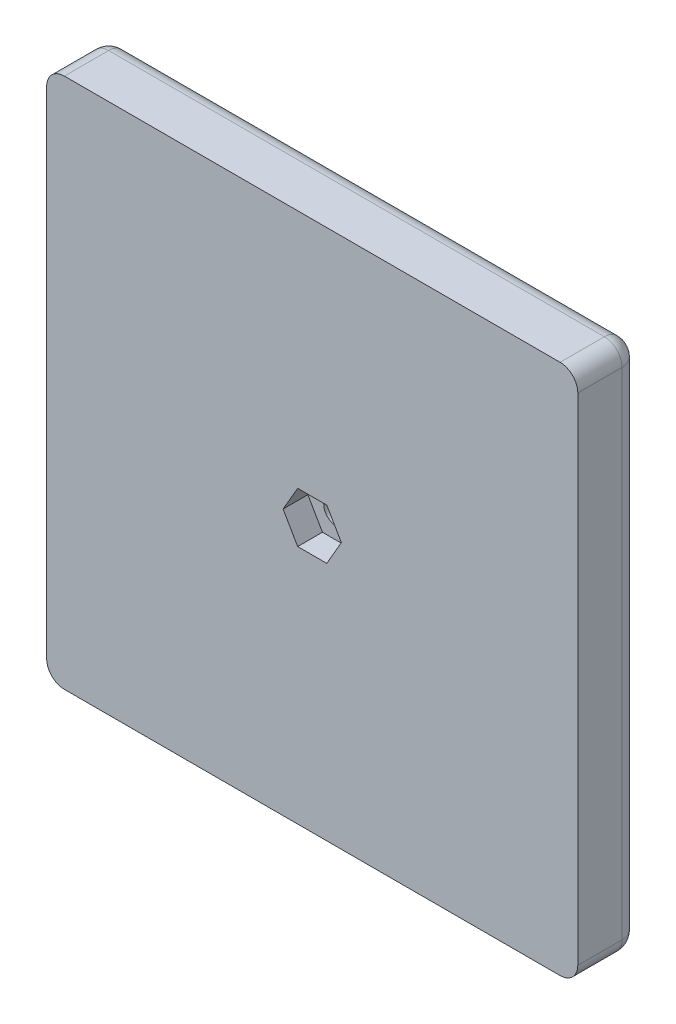
from build123d import *

# Parameters (mm, degrees)
ESBO_O1_W                = 23
ESBO_O1_H                = 23
RESSALTO_EXTRUS_O1_DEPTH = 10.25
CORTE_EXTRUS_O1_REACH    = 21.224
ESBO_O2_R                = 4.2
ESBO_O3_W                = 60
ESBO_O3_H                = 60
RESSALTO_EXTRUS_O2_DEPTH = 7
CORTE_EXTRUS_O2_REACH    = 45.647
ESBO_O4_R                = 1.5
CORTE_EXTRUS_O3_DEPTH    = 2.8
FILETE1_R                = 2
FILETE2_R                = 2


with BuildPart() as part:
    # Esboço1 → Ressalto-extrusão1 (new body)
    with BuildSketch(Plane.XY):
        Rectangle(ESBO_O1_W, ESBO_O1_H)
    extrude(amount=RESSALTO_EXTRUS_O1_DEPTH)

    # Esboço2 → Corte-extrusão1 (cut, up to next)
    with BuildSketch(Plane(origin=(0, 0, 0), x_dir=(-1, 0, 0), z_dir=(0, 0, -1)), mode=Mode.PRIVATE) as corte_extrus_o1_sk1:
        Circle(ESBO_O2_R)
    corte_extrus_o1_tool1 = extrude(corte_extrus_o1_sk1.sketch, amount=-CORTE_EXTRUS_O1_REACH, mode=Mode.PRIVATE) & part.part
    add(corte_extrus_o1_tool1.solids().sort_by_distance((0, 0, 0))[0], mode=Mode.SUBTRACT)

    # Esboço3 → Ressalto-extrusão2 (add)
    with BuildSketch(Plane.XY.offset(10.25)):
        Rectangle(ESBO_O3_W, ESBO_O3_H)
    extrude(amount=RESSALTO_EXTRUS_O2_DEPTH)

    # Esboço4 → Corte-extrusão2 (cut, up to next)
    with BuildSketch(Plane(origin=(0, 0, 10.25), x_dir=(-1, 0, 0), z_dir=(0, 0, -1)), mode=Mode.PRIVATE) as corte_extrus_o2_sk1:
        Circle(ESBO_O4_R)
    corte_extrus_o2_tool1 = extrude(corte_extrus_o2_sk1.sketch, amount=-CORTE_EXTRUS_O2_REACH, mode=Mode.PRIVATE) & part.part
    add(corte_extrus_o2_tool1.solids().sort_by_distance((0, 0, 10.25))[0], mode=Mode.SUBTRACT)

    # Esboço5 → Corte-extrusão3 (cut)
    with BuildSketch(Plane.XY.offset(17.25)):
        Polygon((3.290896534, 0), (1.645448267, 2.85), (-1.645448267, 2.85), (-3.290896534, 0), (-1.645448267, -2.85), (1.645448267, -2.85), align=None)
    extrude(amount=-CORTE_EXTRUS_O3_DEPTH, mode=Mode.SUBTRACT)

    # Filete1
    filete1_edges = [part.edges().sort_by_distance(p)[0] for p in [
        (-30, 0, 10.25),
        (0, -30, 10.25),
        (30, 0, 10.25),
        (0, 30, 10.25),
    ]]
    fillet(filete1_edges, radius=FILETE1_R)

    # Filete2
    # the kernel refuses this fillet: 2 mm, written as the material it takes off along each edge
    with BuildSketch(Plane(origin=(-28, -28, 12.25), x_dir=(-1, 0, 0), z_dir=(0, -1, 0))) as filete2_piece_1_section:
        Polygon((0, 0), (FILETE2_R, 0), (FILETE2_R, FILETE2_R), (0, FILETE2_R), align=None)
    filete2_piece_1 = extrude(amount=FILETE2_R, mode=Mode.PRIVATE)
    filete2_piece_1 = filete2_piece_1 - Plane(origin=(-28, -28, 12.25), x_dir=(0.7071067811865475, 0, 0.7071067811865475), z_dir=(0, -1, 0)) * Sphere(FILETE2_R, mode=Mode.PRIVATE)
    add(filete2_piece_1, mode=Mode.SUBTRACT)
    with BuildSketch(Plane(origin=(-28, 28, 12.25), x_dir=(0, 1, 0), z_dir=(-1, 0, 0))) as filete2_piece_2_section:
        Polygon((0, 0), (FILETE2_R, 0), (FILETE2_R, FILETE2_R), (0, FILETE2_R), align=None)
    filete2_piece_2 = extrude(amount=FILETE2_R, mode=Mode.PRIVATE)
    filete2_piece_2 = filete2_piece_2 - Plane(origin=(-28, 28, 12.25), x_dir=(0, -0.7071067811865475, 0.7071067811865475), z_dir=(-1, 0, 0)) * Sphere(FILETE2_R, mode=Mode.PRIVATE)
    add(filete2_piece_2, mode=Mode.SUBTRACT)
    with BuildSketch(Plane(origin=(28, -28, 12.25), x_dir=(1, 0, 0), z_dir=(0, -1, 0))) as filete2_piece_3_section:
        Polygon((0, 0), (FILETE2_R, 0), (FILETE2_R, -FILETE2_R), (0, -FILETE2_R), align=None)
    filete2_piece_3 = extrude(amount=FILETE2_R, mode=Mode.PRIVATE)
    filete2_piece_3 = filete2_piece_3 - Plane(origin=(28, -28, 12.25), x_dir=(-0.7071067811865475, 0, 0.7071067811865475), z_dir=(0, -1, 0)) * Sphere(FILETE2_R, mode=Mode.PRIVATE)
    add(filete2_piece_3, mode=Mode.SUBTRACT)
    with BuildSketch(Plane(origin=(28, 28, 12.25), x_dir=(0, 1, 0), z_dir=(1, 0, 0))) as filete2_piece_4_section:
        Polygon((0, 0), (FILETE2_R, 0), (FILETE2_R, -FILETE2_R), (0, -FILETE2_R), align=None)
    filete2_piece_4 = extrude(amount=FILETE2_R, mode=Mode.PRIVATE)
    filete2_piece_4 = filete2_piece_4 - Plane(origin=(28, 28, 12.25), x_dir=(0, -0.7071067811865475, 0.7071067811865475), z_dir=(1, 0, 0)) * Sphere(FILETE2_R, mode=Mode.PRIVATE)
    add(filete2_piece_4, mode=Mode.SUBTRACT)
    with BuildSketch(Plane(origin=(-30, 30, 12.25), x_dir=(0, -1, 0), z_dir=(0, 0, 1)), Plane(origin=(-30, -30, 12.25), x_dir=(1, 0, 0), z_dir=(0, 0, 1))) as filete2_piece_5:
        with BuildLine():
            CenterArc((FILETE2_R, FILETE2_R), FILETE2_R, 180, 90)
            Line((0, FILETE2_R), (0, 0))
            Line((0, 0), (FILETE2_R, 0))
        make_face()
    extrude(amount=10, mode=Mode.SUBTRACT)
    with BuildSketch(Plane(origin=(30, -30, 12.25), x_dir=(-1, 0, 0), z_dir=(0, 0, 1)), Plane(origin=(30, 30, 12.25), x_dir=(0, -1, 0), z_dir=(0, 0, 1))) as filete2_piece_6:
        with BuildLine():
            CenterArc((FILETE2_R, -FILETE2_R), FILETE2_R, 90, 90)
            Line((0, -FILETE2_R), (0, 0))
            Line((0, 0), (FILETE2_R, 0))
        make_face()
    extrude(amount=10, mode=Mode.SUBTRACT)


solid = part.part
